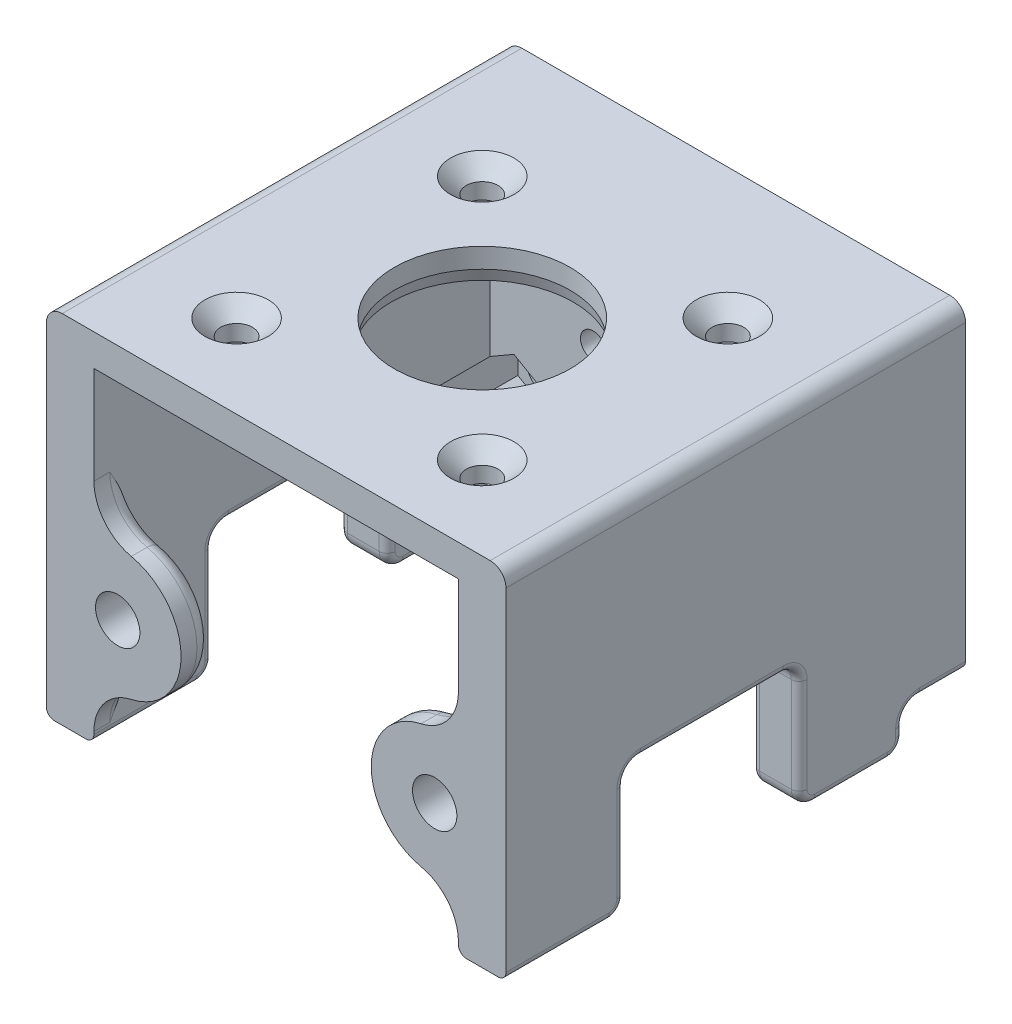
from build123d import *
from OCP.BRepFilletAPI import BRepFilletAPI_MakeChamfer

# Parameters (mm, degrees)
SKIZZE1_W                            = 58
SKIZZE1_H                            = 40
SKIZZE1_R                            = 2.4
SKIZZE1_R_2                          = 1.6
AUFSATZ_LINEAR_AUSTRAGEN1_DEPTH      = 8
AUFSATZ_LINEAR_AUSTRAGEN2_DEPTH      = 50
SKIZZE5_R                            = 11.1
SKIZZE5_R_2                          = 2
SCHNITT_LINEAR_AUSTRAGEN1_DEPTH      = 8
FASE1_SIZE                           = 2
SCHNITT_LINEAR_AUSTRAGEN6_DEPTH      = 10
SCHNITT_LINEAR_AUSTRAGEN6_DEPTH_BACK = 4
SKIZZE10_R                           = 8
SKIZZE10_R_2                         = 2.8
AUFSATZ_LINEAR_AUSTRAGEN3_DEPTH      = 4
SKIZZE13_W                           = 6
SKIZZE13_H                           = 50.174433159
AUFSATZ_LINEAR_AUSTRAGEN4_DEPTH      = 5
VERRUNDUNG1_R                        = 6
VERRUNDUNG3_R                        = 2
SKIZZE11_R                           = 2.8
SCHNITT_LINEAR_AUSTRAGEN7_DEPTH      = 4
FASE3_SIZE                           = 0.4
FASE3_SIZE2                          = 1.492820323
SKIZZE7_R                            = 2
SCHNITT_LINEAR_AUSTRAGEN2_DEPTH      = 6
VERRUNDUNG4_R                        = 2
SKIZZE12_W                           = 58
SKIZZE12_H                           = 22
SCHNITT_LINEAR_AUSTRAGEN8_DEPTH      = 16
VERRUNDUNG5_R                        = 2
FASE4_SIZE                           = 4.5
FASE4_SIZE2                          = 1.205771366
LINEARES_MUSTER1_COUNT               = 2
LINEARES_MUSTER1_PITCH               = 52
VERRUNDUNG6_R                        = 1


# Read off the part's stored shape, not the designer's step: Aufsatz-Linear austragen2
with BuildPart() as part:
    # Skizze1 → Aufsatz-Linear austragen1 (new body)
    with BuildSketch(Plane.XY):
        with Locations((0, -20)):
            Rectangle(SKIZZE1_W, SKIZZE1_H)
        with Locations((-20, -10)):
            Circle(SKIZZE1_R, mode=Mode.SUBTRACT)
        with Locations((0, -10)):
            Circle(SKIZZE1_R, mode=Mode.SUBTRACT)
        with Locations((20, -10)):
            Circle(SKIZZE1_R, mode=Mode.SUBTRACT)
        with Locations((0, -30)):
            Circle(SKIZZE1_R, mode=Mode.SUBTRACT)
        with Locations((20, -30)):
            Circle(SKIZZE1_R, mode=Mode.SUBTRACT)
        with Locations((-20, -30)):
            Circle(SKIZZE1_R, mode=Mode.SUBTRACT)
        with Locations((-10, -20)):
            Circle(SKIZZE1_R_2, mode=Mode.SUBTRACT)
        with Locations((10, -20)):
            Circle(SKIZZE1_R_2, mode=Mode.SUBTRACT)
    extrude(amount=AUFSATZ_LINEAR_AUSTRAGEN1_DEPTH)

    # Aufsatz-Linear austragen2 outline → Aufsatz-Linear austragen2 (add)
    with BuildSketch(Plane.XY.offset(8)):
        Polygon((23, -40), (29, -40), (29, 0), (-29, 0), (-29, -40), (-23, -40), (-23, -4), (23, -4), align=None)
    extrude(amount=AUFSATZ_LINEAR_AUSTRAGEN2_DEPTH)

    # Skizze5 → Schnitt-Linear austragen1 (cut)
    with BuildSketch(Plane(origin=(0, 0, 0), x_dir=(1, 0, 0), z_dir=(0, 1, 0))):
        with Locations(Location((0, -32, 0), (0, 0, 180))):
            Circle(SKIZZE5_R)
        with Locations(Location((-15.5, -16.5, 0), (0, 0, 180))):
            Circle(SKIZZE5_R_2)
        with Locations(Location((15.5, -16.5, 0), (0, 0, 180))):
            Circle(SKIZZE5_R_2)
        with Locations(Location((15.5, -47.5, 0), (0, 0, 180))):
            Circle(SKIZZE5_R_2)
        with Locations(Location((-15.5, -47.5, 0), (0, 0, 180))):
            Circle(SKIZZE5_R_2)
    extrude(amount=-SCHNITT_LINEAR_AUSTRAGEN1_DEPTH, mode=Mode.SUBTRACT)

    # Fase1
    fase1_edges = [part.edges().sort_by_distance(p)[0] for p in [
        (-13.5, 0, 47.5),
        (17.5, 0, 47.5),
        (17.5, 0, 16.5),
        (-13.5, 0, 16.5),
    ]]
    chamfer(fase1_edges, length=FASE1_SIZE)

    # Skizze9 → Schnitt-Linear austragen6 (cut, two sides: drawn at the far end of the back side and taken through both)
    with BuildSketch(Plane.XY.offset(8).offset(-SCHNITT_LINEAR_AUSTRAGEN6_DEPTH_BACK)):
        Polygon((3.5, -7.979274058), (0, -5.958548116), (-3.5, -7.979274058), (-3.5, -12.020725942), (0, -14.041451884), (3.5, -12.020725942), align=None)
        Polygon((-16.5, -7.979274058), (-20, -5.958548116), (-23.5, -7.979274058), (-23.5, -12.020725942), (-20, -14.041451884), (-16.5, -12.020725942), align=None)
        Polygon((23.5, -7.979274058), (20, -5.958548116), (16.5, -7.979274058), (16.5, -12.020725942), (20, -14.041451884), (23.5, -12.020725942), align=None)
        Polygon((3.5, -27.979274058), (0, -25.958548116), (-3.5, -27.979274058), (-3.5, -32.020725942), (0, -34.041451884), (3.5, -32.020725942), align=None)
        Polygon((23.5, -27.979274058), (20, -25.958548116), (16.5, -27.979274058), (16.5, -32.020725942), (20, -34.041451884), (23.5, -32.020725942), align=None)
        Polygon((-16.5, -27.979274058), (-20, -25.958548116), (-23.5, -27.979274058), (-23.5, -32.020725942), (-20, -34.041451884), (-16.5, -32.020725942), align=None)
    extrude(amount=SCHNITT_LINEAR_AUSTRAGEN6_DEPTH + SCHNITT_LINEAR_AUSTRAGEN6_DEPTH_BACK, mode=Mode.SUBTRACT)

    # Skizze10 → Aufsatz-Linear austragen3 (add)
    # profile 1 of 2: a face of its own
    with BuildSketch(Plane.XY.offset(58)):
        with Locations((20, -30)):
            Circle(SKIZZE10_R)
    # profile 2 of 2: a face of its own
    with BuildSketch(Plane.XY.offset(58)):
        with Locations((-20, -30)):
            Circle(SKIZZE10_R)
        with Locations((-20, -30)):
            Circle(SKIZZE10_R_2, mode=Mode.SUBTRACT)
    extrude(amount=-AUFSATZ_LINEAR_AUSTRAGEN3_DEPTH)

    # Skizze13 → Aufsatz-Linear austragen4 (add)
    with BuildSketch(Plane.XZ.offset(40)):
        with Locations((-26, 32.912783421)):
            Rectangle(SKIZZE13_W, SKIZZE13_H)
        with Locations((26, 32.912783421)):
            Rectangle(SKIZZE13_W, SKIZZE13_H)
    extrude(amount=AUFSATZ_LINEAR_AUSTRAGEN4_DEPTH)

    # Verrundung1
    verrundung1_edges = [part.edges().sort_by_distance(p)[0] for p in [
        (23, -37.416198487, 56),
        (23, -22.583801513, 56),
        (-23, -37.416198487, 56),
        (-23, -22.583801513, 56),
    ]]
    fillet(verrundung1_edges, radius=VERRUNDUNG1_R)

    # Verrundung3
    # the kernel refuses this fillet: 2 mm, written as the material it takes off along each edge
    with BuildSketch(Plane(origin=(-20, -30, 54), x_dir=(0.21428571428571433, -0.9767710236555245, 0), z_dir=(-0.9767710236555245, -0.21428571428571433, 0))) as verrundung3_piece_1:
        with BuildLine():
            CenterArc((8 - VERRUNDUNG3_R, VERRUNDUNG3_R), VERRUNDUNG3_R, 270, 90)
            Line((8 - VERRUNDUNG3_R, 0), (8, 0))
            Line((8, 0), (8, VERRUNDUNG3_R))
        make_face()
    revolve(axis=Axis((-20, -30, 54), (0, 0, 1)), revolution_arc=155.252749768, mode=Mode.SUBTRACT)
    with BuildSketch(Plane(origin=(20, -30, 54), x_dir=(-0.21428571428571433, 0.9767710236555245, 0), z_dir=(0.9767710236555245, 0.21428571428571433, 0))) as verrundung3_piece_2:
        with BuildLine():
            CenterArc((8 - VERRUNDUNG3_R, VERRUNDUNG3_R), VERRUNDUNG3_R, 270, 90)
            Line((8 - VERRUNDUNG3_R, 0), (8, 0))
            Line((8, 0), (8, VERRUNDUNG3_R))
        make_face()
    revolve(axis=Axis((20, -30, 54), (0, 0, 1)), revolution_arc=155.252749768, mode=Mode.SUBTRACT)
    with BuildSketch(Plane(origin=(-17, -16.325205669, 54), x_dir=(-0.6722279054593165, 0.7403442733767718, 0), z_dir=(0.7403442733767718, 0.6722279054593165, 0))) as verrundung3_piece_3_section:
        with BuildLine():
            CenterArc((6 + VERRUNDUNG3_R, VERRUNDUNG3_R), VERRUNDUNG3_R, 180, 90)
            Line((6 + VERRUNDUNG3_R, 0), (6, 0))
            Line((6, 0), (6, VERRUNDUNG3_R))
        make_face()
    verrundung3_piece_3 = revolve(axis=Axis((-17, -16.325205669, 54), (0, 0, 1)), revolution_arc=125.387125524, mode=Mode.PRIVATE)
    verrundung3_piece_3 = split(verrundung3_piece_3, bisect_by=Plane(origin=(-23, -20.355034942, 54.516064296), z_dir=(1, 0, 0)), keep=Keep.TOP, mode=Mode.PRIVATE)
    add(verrundung3_piece_3, mode=Mode.SUBTRACT)
    with BuildSketch(Plane(origin=(-17, -43.674794331, 54), x_dir=(-0.6722279054593165, -0.7403442733767718, 0), z_dir=(0.7403442733767718, -0.6722279054593165, 0))) as verrundung3_piece_4_section:
        with BuildLine():
            CenterArc((6 + VERRUNDUNG3_R, -VERRUNDUNG3_R), VERRUNDUNG3_R, 90, 90)
            Line((6, -VERRUNDUNG3_R), (6, 0))
            Line((6, 0), (6 + VERRUNDUNG3_R, 0))
        make_face()
    verrundung3_piece_4 = revolve(axis=Axis((-17, -43.674794331, 54), (0, 0, -1)), revolution_arc=125.387125524, mode=Mode.PRIVATE)
    verrundung3_piece_4 = split(verrundung3_piece_4, bisect_by=Plane(origin=(-23, -39.644965239, 54.51606418), z_dir=(1, 0, 0)), keep=Keep.TOP, mode=Mode.PRIVATE)
    add(verrundung3_piece_4, mode=Mode.SUBTRACT)
    with BuildSketch(Plane(origin=(17, -43.674794331, 54), x_dir=(0.6722279054593165, -0.7403442733767718, 0), z_dir=(-0.7403442733767718, -0.6722279054593165, 0))) as verrundung3_piece_5_section:
        with BuildLine():
            CenterArc((6 + VERRUNDUNG3_R, VERRUNDUNG3_R), VERRUNDUNG3_R, 180, 90)
            Line((6 + VERRUNDUNG3_R, 0), (6, 0))
            Line((6, 0), (6, VERRUNDUNG3_R))
        make_face()
    verrundung3_piece_5 = revolve(axis=Axis((17, -43.674794331, 54), (0, 0, 1)), revolution_arc=125.387125524, mode=Mode.PRIVATE)
    verrundung3_piece_5 = split(verrundung3_piece_5, bisect_by=Plane(origin=(23, -39.644963205, 54.516060737), z_dir=(-1, 0, 0)), keep=Keep.TOP, mode=Mode.PRIVATE)
    add(verrundung3_piece_5, mode=Mode.SUBTRACT)
    with BuildSketch(Plane(origin=(17, -16.325205669, 54), x_dir=(0.672227905459316, 0.7403442733767723, 0), z_dir=(-0.7403442733767723, 0.672227905459316, 0))) as verrundung3_piece_6_section:
        with BuildLine():
            CenterArc((6 + VERRUNDUNG3_R, -VERRUNDUNG3_R), VERRUNDUNG3_R, 90, 90)
            Line((6, -VERRUNDUNG3_R), (6, 0))
            Line((6, 0), (6 + VERRUNDUNG3_R, 0))
        make_face()
    verrundung3_piece_6 = revolve(axis=Axis((17, -16.325205669, 54), (0, 0, -1)), revolution_arc=125.387125524, mode=Mode.PRIVATE)
    verrundung3_piece_6 = split(verrundung3_piece_6, bisect_by=Plane(origin=(23, -20.355037546, 54.516064213), z_dir=(-1, 0, 0)), keep=Keep.TOP, mode=Mode.PRIVATE)
    add(verrundung3_piece_6, mode=Mode.SUBTRACT)

    # Skizze11 → Schnitt-Linear austragen7 (cut)
    with BuildSketch(Plane.XY.offset(58)):
        with Locations((20, -30)):
            Circle(SKIZZE11_R)
    extrude(amount=-SCHNITT_LINEAR_AUSTRAGEN7_DEPTH, mode=Mode.SUBTRACT)

    # Fase3
    fase3_edges = [part.edges().sort_by_distance(p)[0] for p in [
        (11.1, -4, 32),
    ]]
    fase3_side = [part.faces().sort_by_distance(p)[0] for p in [
        (-22.32058849, -4, 33),
    ]]
    chamfer(fase3_edges, length=FASE3_SIZE, length2=FASE3_SIZE2, reference=fase3_side[0])

    # Skizze7 → Schnitt-Linear austragen2 (cut)
    with BuildSketch(Plane.XZ.offset(45)):
        with Locations(Location((26, 15.300827002, 0), (0, 0, 270))):
            Circle(SKIZZE7_R)
        with Locations(Location((26, 50.800827002, 0), (0, 0, 270))):
            Circle(SKIZZE7_R)
    schnitt_linear_austragen2 = extrude(amount=-SCHNITT_LINEAR_AUSTRAGEN2_DEPTH, mode=Mode.SUBTRACT)

    # Verrundung4
    verrundung4_edges = [part.edges().sort_by_distance(p)[0] for p in [
        (-29, 0, 29),
        (29, 0, 29),
    ]]
    fillet(verrundung4_edges, radius=VERRUNDUNG4_R)

    # Skizze12 → Schnitt-Linear austragen8 (cut)
    with BuildSketch(Plane.XZ.offset(45)):
        with Locations((0, 32)):
            Rectangle(SKIZZE12_W, SKIZZE12_H)
    extrude(amount=-SCHNITT_LINEAR_AUSTRAGEN8_DEPTH, mode=Mode.SUBTRACT)

    # Verrundung5
    verrundung5_edges = [part.edges().sort_by_distance(p)[0] for p in [
        (-26, -40, 7.825566841),
        (-26, -45, 7.825566841),
        (26, -40, 7.825566841),
        (26, -45, 7.825566841),
        (26, -45, 21),
        (-26, -45, 21),
        (-26, -45, 43),
        (-26, -29, 43),
        (-26, -29, 21),
        (26, -29, 43),
        (26, -29, 21),
        (26, -45, 43),
    ]]
    fillet(verrundung5_edges, radius=VERRUNDUNG5_R)

    # Fase4: one chamfer whose edges measure the first distance from different faces: ONE call of the kernel's chamfer builder (chamfer() names one face for all edges)
    fase4_edges_1 = [part.edges().sort_by_distance(p)[0] for p in [
        (-11.6, -20, 0),
    ]]
    fase4_side_1 = [part.faces().sort_by_distance(p)[0] for p in [
        (-11.6, -20, 4),
    ]]
    fase4_edges_2 = [part.edges().sort_by_distance(p)[0] for p in [
        (8.4, -20, 0),
    ]]
    fase4_side_2 = [part.faces().sort_by_distance(p)[0] for p in [
        (8.4, -20, 4),
    ]]
    fase4 = BRepFilletAPI_MakeChamfer(part.part.solid().wrapped)
    for e in fase4_edges_1:
        fase4.Add(FASE4_SIZE, FASE4_SIZE2, e.wrapped, fase4_side_1[0].wrapped)  # the first distance lies on this face
    for e in fase4_edges_2:
        fase4.Add(FASE4_SIZE, FASE4_SIZE2, e.wrapped, fase4_side_2[0].wrapped)  # the first distance lies on this face
    add(Compound.cast(fase4.Shape()), mode=Mode.REPLACE)

    # Lineares Muster1: Schnitt-Linear austragen2 ×2
    with Locations(*[(-i * LINEARES_MUSTER1_PITCH, 0, 0) for i in range(1, LINEARES_MUSTER1_COUNT)]):
        add(schnitt_linear_austragen2, mode=Mode.SUBTRACT)

    # Verrundung6
    # the kernel refuses this fillet: 1 mm, written as the material it takes off along each edge
    with BuildSketch(Plane(origin=(-23, -42, 5.825566841), x_dir=(0, 0.3148458040869784, -0.9491428341660828), z_dir=(0, -0.9491428341660828, -0.3148458040869784))) as verrundung6_piece_1_section:
        with BuildLine():
            CenterArc((2 + VERRUNDUNG6_R, -VERRUNDUNG6_R), VERRUNDUNG6_R, 90, 90)
            Line((2, -VERRUNDUNG6_R), (2, 0))
            Line((2, 0), (2 + VERRUNDUNG6_R, 0))
        make_face()
    verrundung6_piece_1 = revolve(axis=Axis((-23, -42, 5.825566841), (1, 0, 0)), revolution_arc=161.648494619, mode=Mode.PRIVATE)
    verrundung6_piece_1 = split(verrundung6_piece_1, bisect_by=Plane(origin=(-23.272151062, -40, 7.287763131), z_dir=(0, -1, 0)), keep=Keep.TOP, mode=Mode.PRIVATE)
    add(verrundung6_piece_1, mode=Mode.SUBTRACT)
    with BuildSketch(Plane(origin=(-23, -42, 5.825566841), x_dir=(0, 0.3148458040869784, -0.9491428341660828), z_dir=(0, -0.9491428341660828, -0.3148458040869784))) as verrundung6_piece_2_section:
        with BuildLine():
            CenterArc((2 + VERRUNDUNG6_R, -VERRUNDUNG6_R), VERRUNDUNG6_R, 90, 90)
            Line((2, -VERRUNDUNG6_R), (2, 0))
            Line((2, 0), (2 + VERRUNDUNG6_R, 0))
        make_face()
    verrundung6_piece_2 = revolve(axis=Axis((-23, -42, 5.825566841), (1, 0, 0)), revolution_arc=161.648494619, mode=Mode.PRIVATE)
    verrundung6_piece_2 = split(verrundung6_piece_2, bisect_by=Plane(origin=(-23.00020869, -39.986552232, 8), z_dir=(0, 0, 1)), keep=Keep.TOP, mode=Mode.PRIVATE)
    add(verrundung6_piece_2, mode=Mode.SUBTRACT)
    with BuildSketch(Plane(origin=(-23, -42, 7.825566841), x_dir=(0, 0, 1), z_dir=(0, -1, 0)), Plane(origin=(29, -42, 7.825566841), x_dir=(0, 0, 1), z_dir=(0, -1, 0))) as verrundung6_piece_3:
        with BuildLine():
            CenterArc((VERRUNDUNG6_R, VERRUNDUNG6_R), VERRUNDUNG6_R, 180, 90)
            Line((0, VERRUNDUNG6_R), (0, 0))
            Line((0, 0), (VERRUNDUNG6_R, 0))
        make_face()
    extrude(amount=1, mode=Mode.SUBTRACT)
    with BuildSketch(Plane(origin=(-23, -43, 9.825566841), x_dir=(0, -1, 0), z_dir=(0, 0, 1))) as verrundung6_piece_4:
        with BuildLine():
            CenterArc((2 - VERRUNDUNG6_R, -VERRUNDUNG6_R), VERRUNDUNG6_R, 0, 90)
            Line((2, -VERRUNDUNG6_R), (2, 0))
            Line((2, 0), (2 - VERRUNDUNG6_R, 0))
        make_face()
    revolve(axis=Axis((-23, -43, 9.825566841), (1, 0, 0)), revolution_arc=90, mode=Mode.SUBTRACT)
    with BuildSketch(Plane(origin=(-23, -45, 9.825566841), x_dir=(0, 1, 0), z_dir=(0, 0, 1))) as verrundung6_piece_5:
        with BuildLine():
            CenterArc((VERRUNDUNG6_R, VERRUNDUNG6_R), VERRUNDUNG6_R, 180, 90)
            Line((0, VERRUNDUNG6_R), (0, 0))
            Line((0, 0), (VERRUNDUNG6_R, 0))
        make_face()
    extrude(amount=9.174433159, mode=Mode.SUBTRACT)
    with BuildSketch(Plane(origin=(-23, -43, 19), x_dir=(0, 0, 1), z_dir=(0, 1, 0))) as verrundung6_piece_6:
        with BuildLine():
            CenterArc((2 - VERRUNDUNG6_R, -VERRUNDUNG6_R), VERRUNDUNG6_R, 0, 90)
            Line((2, -VERRUNDUNG6_R), (2, 0))
            Line((2, 0), (2 - VERRUNDUNG6_R, 0))
        make_face()
    revolve(axis=Axis((-23, -43, 19), (1, 0, 0)), revolution_arc=90, mode=Mode.SUBTRACT)
    with BuildSketch(Plane(origin=(-23, -43, 21), x_dir=(0, 0, -1), z_dir=(0, 1, 0)), Plane(origin=(-23, -31, 43), x_dir=(0, 0, 1), z_dir=(0, -1, 0)), Plane(origin=(-29, -43, 43), x_dir=(0, 0, 1), z_dir=(0, 1, 0)), Plane(origin=(23, -31, 21), x_dir=(0, 0, -1), z_dir=(0, -1, 0)), Plane(origin=(23, -43, 43), x_dir=(0, 0, 1), z_dir=(0, 1, 0)), Plane(origin=(29, -43, 21), x_dir=(0, 0, -1), z_dir=(0, 1, 0))) as verrundung6_piece_7:
        with BuildLine():
            CenterArc((VERRUNDUNG6_R, VERRUNDUNG6_R), VERRUNDUNG6_R, 180, 90)
            Line((0, VERRUNDUNG6_R), (0, 0))
            Line((0, 0), (VERRUNDUNG6_R, 0))
        make_face()
    extrude(amount=12, mode=Mode.SUBTRACT)
    with BuildSketch(Plane(origin=(-23, -31, 23), x_dir=(0, 1, 0), z_dir=(0, 0, 1))) as verrundung6_piece_8:
        with BuildLine():
            CenterArc((2 + VERRUNDUNG6_R, VERRUNDUNG6_R), VERRUNDUNG6_R, 180, 90)
            Line((2, VERRUNDUNG6_R), (2, 0))
            Line((2, 0), (2 + VERRUNDUNG6_R, 0))
        make_face()
    revolve(axis=Axis((-23, -31, 23), (-1, 0, 0)), revolution_arc=90, mode=Mode.SUBTRACT)
    with BuildSketch(Plane(origin=(-23, -29, 41), x_dir=(0, 1, 0), z_dir=(0, 0, -1)), Plane(origin=(-29, -29, 23), x_dir=(0, 1, 0), z_dir=(0, 0, 1)), Plane(origin=(23, -29, 23), x_dir=(0, 1, 0), z_dir=(0, 0, 1)), Plane(origin=(29, -29, 41), x_dir=(0, 1, 0), z_dir=(0, 0, -1))) as verrundung6_piece_9:
        with BuildLine():
            CenterArc((VERRUNDUNG6_R, -VERRUNDUNG6_R), VERRUNDUNG6_R, 90, 90)
            Line((0, -VERRUNDUNG6_R), (0, 0))
            Line((0, 0), (VERRUNDUNG6_R, 0))
        make_face()
    extrude(amount=18, mode=Mode.SUBTRACT)
    with BuildSketch(Plane(origin=(-23, -31, 41), x_dir=(0, 0, 1), z_dir=(0, -1, 0))) as verrundung6_piece_10:
        with BuildLine():
            CenterArc((2 + VERRUNDUNG6_R, VERRUNDUNG6_R), VERRUNDUNG6_R, 180, 90)
            Line((2, VERRUNDUNG6_R), (2, 0))
            Line((2, 0), (2 + VERRUNDUNG6_R, 0))
        make_face()
    revolve(axis=Axis((-23, -31, 41), (-1, 0, 0)), revolution_arc=90, mode=Mode.SUBTRACT)
    with BuildSketch(Plane(origin=(-23, -43, 45), x_dir=(0, -1, 0), z_dir=(0, 0, 1))) as verrundung6_piece_11:
        with BuildLine():
            CenterArc((2 - VERRUNDUNG6_R, -VERRUNDUNG6_R), VERRUNDUNG6_R, 0, 90)
            Line((2, -VERRUNDUNG6_R), (2, 0))
            Line((2, 0), (2 - VERRUNDUNG6_R, 0))
        make_face()
    revolve(axis=Axis((-23, -43, 45), (1, 0, 0)), revolution_arc=90, mode=Mode.SUBTRACT)
    with BuildSketch(Plane(origin=(-29, -40, -2.5), x_dir=(1, 0, 0), z_dir=(0, 0, 1)), Plane(origin=(29, -40, 5.825566841), x_dir=(-1, 0, 0), z_dir=(0, 0, -1))) as verrundung6_piece_12:
        with BuildLine():
            CenterArc((VERRUNDUNG6_R, VERRUNDUNG6_R), VERRUNDUNG6_R, 180, 90)
            Line((0, VERRUNDUNG6_R), (0, 0))
            Line((0, 0), (VERRUNDUNG6_R, 0))
        make_face()
    extrude(amount=8.325566841, mode=Mode.SUBTRACT)
    with BuildSketch(Plane(origin=(-29, -42, 5.825566841), x_dir=(0, 1, 0), z_dir=(0, 0, -1))) as verrundung6_piece_13:
        with BuildLine():
            CenterArc((2 + VERRUNDUNG6_R, VERRUNDUNG6_R), VERRUNDUNG6_R, 180, 90)
            Line((2, VERRUNDUNG6_R), (2, 0))
            Line((2, 0), (2 + VERRUNDUNG6_R, 0))
        make_face()
    revolve(axis=Axis((-29, -42, 5.825566841), (1, 0, 0)), revolution_arc=90, mode=Mode.SUBTRACT)
    with BuildSketch(Plane(origin=(-29, -42, 7.825566841), x_dir=(0, 0, 1), z_dir=(0, -1, 0)), Plane(origin=(23, -42, 7.825566841), x_dir=(0, 0, 1), z_dir=(0, -1, 0))) as verrundung6_piece_14:
        with BuildLine():
            CenterArc((VERRUNDUNG6_R, -VERRUNDUNG6_R), VERRUNDUNG6_R, 90, 90)
            Line((0, -VERRUNDUNG6_R), (0, 0))
            Line((0, 0), (VERRUNDUNG6_R, 0))
        make_face()
    extrude(amount=1, mode=Mode.SUBTRACT)
    with BuildSketch(Plane(origin=(-29, -43, 9.825566841), x_dir=(0, -1, 0), z_dir=(0, 0, 1))) as verrundung6_piece_15:
        with BuildLine():
            CenterArc((2 - VERRUNDUNG6_R, VERRUNDUNG6_R), VERRUNDUNG6_R, 270, 90)
            Line((2, VERRUNDUNG6_R), (2, 0))
            Line((2, 0), (2 - VERRUNDUNG6_R, 0))
        make_face()
    revolve(axis=Axis((-29, -43, 9.825566841), (1, 0, 0)), revolution_arc=90, mode=Mode.SUBTRACT)
    with BuildSketch(Plane(origin=(-29, -45, 9.825566841), x_dir=(0, 1, 0), z_dir=(0, 0, 1)), Plane(origin=(23, -45, 9.825566841), x_dir=(0, 1, 0), z_dir=(0, 0, 1)), Plane(origin=(29, -45, 19), x_dir=(0, 1, 0), z_dir=(0, 0, -1))) as verrundung6_piece_16:
        with BuildLine():
            CenterArc((VERRUNDUNG6_R, -VERRUNDUNG6_R), VERRUNDUNG6_R, 90, 90)
            Line((0, -VERRUNDUNG6_R), (0, 0))
            Line((0, 0), (VERRUNDUNG6_R, 0))
        make_face()
    extrude(amount=9.174433159, mode=Mode.SUBTRACT)
    with BuildSketch(Plane(origin=(-29, -43, 19), x_dir=(0, 0, 1), z_dir=(0, 1, 0))) as verrundung6_piece_17:
        with BuildLine():
            CenterArc((2 - VERRUNDUNG6_R, VERRUNDUNG6_R), VERRUNDUNG6_R, 270, 90)
            Line((2, VERRUNDUNG6_R), (2, 0))
            Line((2, 0), (2 - VERRUNDUNG6_R, 0))
        make_face()
    revolve(axis=Axis((-29, -43, 19), (1, 0, 0)), revolution_arc=90, mode=Mode.SUBTRACT)
    with BuildSketch(Plane(origin=(-29, -43, 21), x_dir=(0, 0, -1), z_dir=(0, 1, 0)), Plane(origin=(29, -43, 43), x_dir=(0, 0, 1), z_dir=(0, 1, 0))) as verrundung6_piece_18:
        with BuildLine():
            CenterArc((VERRUNDUNG6_R, -VERRUNDUNG6_R), VERRUNDUNG6_R, 90, 90)
            Line((0, -VERRUNDUNG6_R), (0, 0))
            Line((0, 0), (VERRUNDUNG6_R, 0))
        make_face()
    extrude(amount=12, mode=Mode.SUBTRACT)
    with BuildSketch(Plane(origin=(-29, -31, 23), x_dir=(0, 1, 0), z_dir=(0, 0, 1))) as verrundung6_piece_19:
        with BuildLine():
            CenterArc((2 + VERRUNDUNG6_R, -VERRUNDUNG6_R), VERRUNDUNG6_R, 90, 90)
            Line((2, -VERRUNDUNG6_R), (2, 0))
            Line((2, 0), (2 + VERRUNDUNG6_R, 0))
        make_face()
    revolve(axis=Axis((-29, -31, 23), (-1, 0, 0)), revolution_arc=90, mode=Mode.SUBTRACT)
    with BuildSketch(Plane(origin=(-29, -31, 41), x_dir=(0, 0, 1), z_dir=(0, -1, 0))) as verrundung6_piece_20:
        with BuildLine():
            CenterArc((2 + VERRUNDUNG6_R, -VERRUNDUNG6_R), VERRUNDUNG6_R, 90, 90)
            Line((2, -VERRUNDUNG6_R), (2, 0))
            Line((2, 0), (2 + VERRUNDUNG6_R, 0))
        make_face()
    revolve(axis=Axis((-29, -31, 41), (-1, 0, 0)), revolution_arc=90, mode=Mode.SUBTRACT)
    with BuildSketch(Plane(origin=(-29, -43, 45), x_dir=(0, -1, 0), z_dir=(0, 0, 1))) as verrundung6_piece_21:
        with BuildLine():
            CenterArc((2 - VERRUNDUNG6_R, VERRUNDUNG6_R), VERRUNDUNG6_R, 270, 90)
            Line((2, VERRUNDUNG6_R), (2, 0))
            Line((2, 0), (2 - VERRUNDUNG6_R, 0))
        make_face()
    revolve(axis=Axis((-29, -43, 45), (1, 0, 0)), revolution_arc=90, mode=Mode.SUBTRACT)
    with BuildSketch(Plane(origin=(-23, -45, 45), x_dir=(0, 1, 0), z_dir=(0, 0, 1))) as verrundung6_piece_22:
        with BuildLine():
            CenterArc((VERRUNDUNG6_R, VERRUNDUNG6_R), VERRUNDUNG6_R, 180, 90)
            Line((0, VERRUNDUNG6_R), (0, 0))
            Line((0, 0), (VERRUNDUNG6_R, 0))
        make_face()
    extrude(amount=15.5, mode=Mode.SUBTRACT)
    with BuildSketch(Plane(origin=(-29, -45, 45), x_dir=(0, 1, 0), z_dir=(0, 0, 1)), Plane(origin=(23, -45, 45), x_dir=(0, 1, 0), z_dir=(0, 0, 1)), Plane(origin=(29, -45, 60.5), x_dir=(0, 1, 0), z_dir=(0, 0, -1))) as verrundung6_piece_23:
        with BuildLine():
            CenterArc((VERRUNDUNG6_R, -VERRUNDUNG6_R), VERRUNDUNG6_R, 90, 90)
            Line((0, -VERRUNDUNG6_R), (0, 0))
            Line((0, 0), (VERRUNDUNG6_R, 0))
        make_face()
    extrude(amount=15.5, mode=Mode.SUBTRACT)
    with BuildSketch(Plane(origin=(23, -42, 5.825566841), x_dir=(0, 0.3148458040869784, -0.9491428341660828), z_dir=(0, -0.9491428341660828, -0.3148458040869784))) as verrundung6_piece_24_section:
        with BuildLine():
            CenterArc((2 + VERRUNDUNG6_R, VERRUNDUNG6_R), VERRUNDUNG6_R, 180, 90)
            Line((2, VERRUNDUNG6_R), (2, 0))
            Line((2, 0), (2 + VERRUNDUNG6_R, 0))
        make_face()
    verrundung6_piece_24 = revolve(axis=Axis((23, -42, 5.825566841), (1, 0, 0)), revolution_arc=161.648494619, mode=Mode.PRIVATE)
    verrundung6_piece_24 = split(verrundung6_piece_24, bisect_by=Plane(origin=(23.272151116, -40, 7.287763135), z_dir=(0, -1, 0)), keep=Keep.TOP, mode=Mode.PRIVATE)
    add(verrundung6_piece_24, mode=Mode.SUBTRACT)
    with BuildSketch(Plane(origin=(23, -42, 5.825566841), x_dir=(0, 0.3148458040869784, -0.9491428341660828), z_dir=(0, -0.9491428341660828, -0.3148458040869784))) as verrundung6_piece_25_section:
        with BuildLine():
            CenterArc((2 + VERRUNDUNG6_R, VERRUNDUNG6_R), VERRUNDUNG6_R, 180, 90)
            Line((2, VERRUNDUNG6_R), (2, 0))
            Line((2, 0), (2 + VERRUNDUNG6_R, 0))
        make_face()
    verrundung6_piece_25 = revolve(axis=Axis((23, -42, 5.825566841), (1, 0, 0)), revolution_arc=161.648494619, mode=Mode.PRIVATE)
    verrundung6_piece_25 = split(verrundung6_piece_25, bisect_by=Plane(origin=(23.00020869, -39.986552232, 8), z_dir=(0, 0, 1)), keep=Keep.TOP, mode=Mode.PRIVATE)
    add(verrundung6_piece_25, mode=Mode.SUBTRACT)
    with BuildSketch(Plane(origin=(23, -43, 9.825566841), x_dir=(0, 0, -1), z_dir=(0, 1, 0))) as verrundung6_piece_26:
        with BuildLine():
            CenterArc((2 - VERRUNDUNG6_R, -VERRUNDUNG6_R), VERRUNDUNG6_R, 0, 90)
            Line((2, -VERRUNDUNG6_R), (2, 0))
            Line((2, 0), (2 - VERRUNDUNG6_R, 0))
        make_face()
    revolve(axis=Axis((23, -43, 9.825566841), (-1, 0, 0)), revolution_arc=90, mode=Mode.SUBTRACT)
    with BuildSketch(Plane(origin=(23, -43, 19), x_dir=(0, -1, 0), z_dir=(0, 0, -1))) as verrundung6_piece_27:
        with BuildLine():
            CenterArc((2 - VERRUNDUNG6_R, -VERRUNDUNG6_R), VERRUNDUNG6_R, 0, 90)
            Line((2, -VERRUNDUNG6_R), (2, 0))
            Line((2, 0), (2 - VERRUNDUNG6_R, 0))
        make_face()
    revolve(axis=Axis((23, -43, 19), (-1, 0, 0)), revolution_arc=90, mode=Mode.SUBTRACT)
    with BuildSketch(Plane(origin=(23, -31, 23), x_dir=(0, 0, -1), z_dir=(0, -1, 0))) as verrundung6_piece_28:
        with BuildLine():
            CenterArc((2 + VERRUNDUNG6_R, VERRUNDUNG6_R), VERRUNDUNG6_R, 180, 90)
            Line((2, VERRUNDUNG6_R), (2, 0))
            Line((2, 0), (2 + VERRUNDUNG6_R, 0))
        make_face()
    revolve(axis=Axis((23, -31, 23), (1, 0, 0)), revolution_arc=90, mode=Mode.SUBTRACT)
    with BuildSketch(Plane(origin=(23, -31, 41), x_dir=(0, 1, 0), z_dir=(0, 0, -1))) as verrundung6_piece_29:
        with BuildLine():
            CenterArc((2 + VERRUNDUNG6_R, VERRUNDUNG6_R), VERRUNDUNG6_R, 180, 90)
            Line((2, VERRUNDUNG6_R), (2, 0))
            Line((2, 0), (2 + VERRUNDUNG6_R, 0))
        make_face()
    revolve(axis=Axis((23, -31, 41), (1, 0, 0)), revolution_arc=90, mode=Mode.SUBTRACT)
    with BuildSketch(Plane(origin=(23, -43, 45), x_dir=(0, -1, 0), z_dir=(0, 0, 1))) as verrundung6_piece_30:
        with BuildLine():
            CenterArc((2 - VERRUNDUNG6_R, VERRUNDUNG6_R), VERRUNDUNG6_R, 270, 90)
            Line((2, VERRUNDUNG6_R), (2, 0))
            Line((2, 0), (2 - VERRUNDUNG6_R, 0))
        make_face()
    revolve(axis=Axis((23, -43, 45), (1, 0, 0)), revolution_arc=90, mode=Mode.SUBTRACT)
    with BuildSketch(Plane(origin=(29, -42, 5.825566841), x_dir=(0, 1, 0), z_dir=(0, 0, -1))) as verrundung6_piece_31:
        with BuildLine():
            CenterArc((2 + VERRUNDUNG6_R, -VERRUNDUNG6_R), VERRUNDUNG6_R, 90, 90)
            Line((2, -VERRUNDUNG6_R), (2, 0))
            Line((2, 0), (2 + VERRUNDUNG6_R, 0))
        make_face()
    revolve(axis=Axis((29, -42, 5.825566841), (1, 0, 0)), revolution_arc=90, mode=Mode.SUBTRACT)
    with BuildSketch(Plane(origin=(29, -43, 9.825566841), x_dir=(0, 0, -1), z_dir=(0, 1, 0))) as verrundung6_piece_32:
        with BuildLine():
            CenterArc((2 - VERRUNDUNG6_R, VERRUNDUNG6_R), VERRUNDUNG6_R, 270, 90)
            Line((2, VERRUNDUNG6_R), (2, 0))
            Line((2, 0), (2 - VERRUNDUNG6_R, 0))
        make_face()
    revolve(axis=Axis((29, -43, 9.825566841), (-1, 0, 0)), revolution_arc=90, mode=Mode.SUBTRACT)
    with BuildSketch(Plane(origin=(29, -43, 19), x_dir=(0, -1, 0), z_dir=(0, 0, -1))) as verrundung6_piece_33:
        with BuildLine():
            CenterArc((2 - VERRUNDUNG6_R, VERRUNDUNG6_R), VERRUNDUNG6_R, 270, 90)
            Line((2, VERRUNDUNG6_R), (2, 0))
            Line((2, 0), (2 - VERRUNDUNG6_R, 0))
        make_face()
    revolve(axis=Axis((29, -43, 19), (-1, 0, 0)), revolution_arc=90, mode=Mode.SUBTRACT)
    with BuildSketch(Plane(origin=(29, -31, 23), x_dir=(0, 0, -1), z_dir=(0, -1, 0))) as verrundung6_piece_34:
        with BuildLine():
            CenterArc((2 + VERRUNDUNG6_R, -VERRUNDUNG6_R), VERRUNDUNG6_R, 90, 90)
            Line((2, -VERRUNDUNG6_R), (2, 0))
            Line((2, 0), (2 + VERRUNDUNG6_R, 0))
        make_face()
    revolve(axis=Axis((29, -31, 23), (1, 0, 0)), revolution_arc=90, mode=Mode.SUBTRACT)
    with BuildSketch(Plane(origin=(29, -31, 41), x_dir=(0, 1, 0), z_dir=(0, 0, -1))) as verrundung6_piece_35:
        with BuildLine():
            CenterArc((2 + VERRUNDUNG6_R, -VERRUNDUNG6_R), VERRUNDUNG6_R, 90, 90)
            Line((2, -VERRUNDUNG6_R), (2, 0))
            Line((2, 0), (2 + VERRUNDUNG6_R, 0))
        make_face()
    revolve(axis=Axis((29, -31, 41), (1, 0, 0)), revolution_arc=90, mode=Mode.SUBTRACT)
    with BuildSketch(Plane(origin=(29, -43, 45), x_dir=(0, -1, 0), z_dir=(0, 0, 1))) as verrundung6_piece_36:
        with BuildLine():
            CenterArc((2 - VERRUNDUNG6_R, -VERRUNDUNG6_R), VERRUNDUNG6_R, 0, 90)
            Line((2, -VERRUNDUNG6_R), (2, 0))
            Line((2, 0), (2 - VERRUNDUNG6_R, 0))
        make_face()
    revolve(axis=Axis((29, -43, 45), (1, 0, 0)), revolution_arc=90, mode=Mode.SUBTRACT)


solid = part.part
